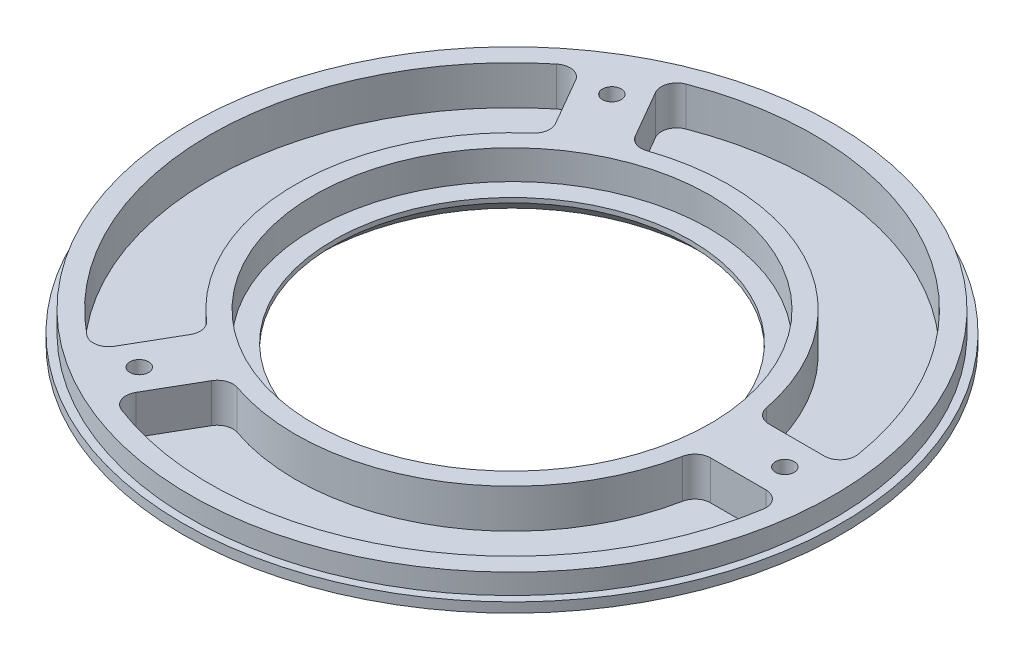
from build123d import *

# Parameters (mm, degrees)
F_90_0_0087_DIAMETER_HOLE1_D = 0.22098
CIRPATTERN3_COUNT            = 3
CUT_EXTRUDE1_DEPTH           = 10
FILLET1_R                    = 4
CIRPATTERN4_COUNT            = 3
FILLET1_OF_CIRPATTERN4_R     = 4
CHAMFER1_SIZE                = 4
BOSS_EXTRUDE1_START          = -7.5
SKETCH10_R                   = 84.55
SKETCH10_R_2                 = 82.55
BOSS_EXTRUDE1_DEPTH          = 7.5
CHAMFER3_SIZE                = 5
CHAMFER3_SIZE2               = 8.660254038
FILLET4_R                    = 5
F_12_0_189_DIAMETER_HOLE1_D  = 4.8006
CIRPATTERN5_COUNT            = 3


with BuildPart() as part:
    # Sketch2 → Revolve1 (revolve)
    with BuildSketch(Plane(origin=(0, 0, 0), x_dir=(0, 0, -1), z_dir=(1, 0, 0))):
        Polygon((-45.8, 0), (-82.55, 0), (-82.55, 12.7), (-50.8, 12.7), (-50.8, 5.2), (-45.8, 5.2), align=None)
    revolve(axis=Axis((0, -0.900399161, 0), (0, 1, 0)))

    # #90 (0.0087) Diameter Hole1 (through all)
    with Locations(Plane(origin=(0, 12.7, 0), x_dir=(1, 0, 0), z_dir=(0, 1, 0))):
        with Locations((-35, 60.621778265)):
            f_90_0_0087_diameter_hole1 = Hole(F_90_0_0087_DIAMETER_HOLE1_D / 2)

    # CirPattern3: #90 (0.0087) Diameter Hole1 ×3 about axis
    cirpattern3_axis = Axis((0, -0.900399161, 0), (0, 1, 0))
    for i in range(1, CIRPATTERN3_COUNT):
        add(f_90_0_0087_diameter_hole1.rotate(cirpattern3_axis, i * 360 / CIRPATTERN3_COUNT), mode=Mode.SUBTRACT)

    # Sketch8 → Cut-Extrude1 (cut)
    with BuildSketch(Plane(origin=(0, 12.7, 0), x_dir=(1, 0, 0), z_dir=(0, 1, 0))):
        with BuildLine():
            Line((-21.025494874, 51.417225376), (-32.098048841, 70.595451416))
            ThreePointArc((-32.098048841, 70.595451416), (38.775, 67.160270063), (77.186478738, 7.5))
            Line((77.186478738, 7.5), (55.041370804, 7.5))
            ThreePointArc((55.041370804, 7.5), (27.775, 48.10771118), (-21.025494874, 51.417225376))
        make_face()
    cut_extrude1 = extrude(amount=-CUT_EXTRUDE1_DEPTH, mode=Mode.SUBTRACT)

    # Fillet1
    fillet1_edges = [part.edges().sort_by_distance(p)[0] for p in [
        (-21.025494874, 7.7, -51.417225376),
        (55.041370804, 7.7, -7.5),
        (77.186478738, 7.7, -7.5),
        (-32.098048841, 7.7, -70.595451416),
    ]]
    fillet(fillet1_edges, radius=FILLET1_R)

    # CirPattern4: Cut-Extrude1 ×3 about axis
    cirpattern4_axis = Axis((0, -0.900399161, 0), (0, 1, 0))
    for i in range(1, CIRPATTERN4_COUNT):
        add(cut_extrude1.rotate(cirpattern4_axis, i * 360 / CIRPATTERN4_COUNT), mode=Mode.SUBTRACT)

    # Fillet1 of CirPattern4
    fillet1_of_cirpattern4_edges = [part.edges().sort_by_distance(p)[0] for p in [
        (-34.01587593, 7.7, 43.917225376),
        (-34.01587593, 7.7, -43.917225376),
        (-45.088429897, 7.7, -63.095451416),
        (-45.088429897, 7.7, 63.095451416),
        (55.041370804, 7.7, 7.5),
        (-21.025494874, 7.7, 51.417225376),
        (-32.098048841, 7.7, 70.595451416),
        (77.186478738, 7.7, 7.5),
    ]]
    fillet(fillet1_of_cirpattern4_edges, radius=FILLET1_OF_CIRPATTERN4_R)

    # Chamfer1
    chamfer1_edges = [part.edges().sort_by_distance(p)[0] for p in [
        (0, 0, -45.8),
    ]]
    chamfer(chamfer1_edges, length=CHAMFER1_SIZE)

    # Sketch10 → Boss-Extrude1 (add)
    with BuildSketch(Plane.XZ.offset(BOSS_EXTRUDE1_START)):
        Circle(SKETCH10_R)
        Circle(SKETCH10_R_2, mode=Mode.SUBTRACT)
    extrude(amount=BOSS_EXTRUDE1_DEPTH)

    # Chamfer3
    chamfer3_edges = [part.edges().sort_by_distance(p)[0] for p in [
        (-84.55, 0, 0),
    ]]
    chamfer3_side = [part.faces().sort_by_distance(p)[0] for p in [
        (-84.55, 3.75, 0),
    ]]
    chamfer(chamfer3_edges, length=CHAMFER3_SIZE, length2=CHAMFER3_SIZE2, reference=chamfer3_side[0])

    # Fillet4
    fillet4_edges = [part.edges().sort_by_distance(p)[0] for p in [
        (-75.889745962, 0, 0),
    ]]
    fillet(fillet4_edges, radius=FILLET4_R)

    # #12 (0.189) Diameter Hole1 (through all)
    with Locations(Plane(origin=(0, 0, 0), x_dir=(-1, 0, 0), z_dir=(0, -1, 0))):
        with Locations((35, 60.621778265)):
            f_12_0_189_diameter_hole1 = Hole(F_12_0_189_DIAMETER_HOLE1_D / 2)

    # CirPattern5: #12 (0.189) Diameter Hole1 ×3 about axis
    cirpattern5_axis = Axis((0, -0.900399161, 0), (0, 1, 0))
    for i in range(1, CIRPATTERN5_COUNT):
        add(f_12_0_189_diameter_hole1.rotate(cirpattern5_axis, i * 360 / CIRPATTERN5_COUNT), mode=Mode.SUBTRACT)


solid = part.part
